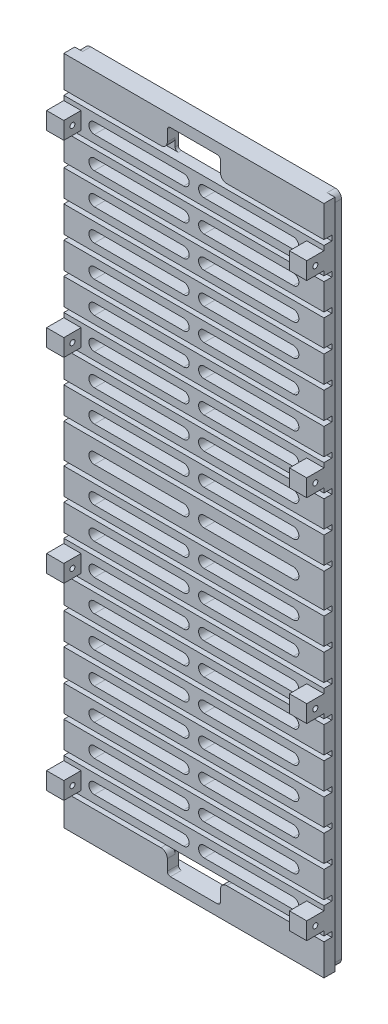
from build123d import *

# Parameters (mm, degrees)
SKETCH1_W                 = 83
SKETCH1_H                 = 214
BOSS_EXTRUDE1_DEPTH       = 8.4
SKETCH2_W                 = 77
SKETCH2_H                 = 4.9
CUT_EXTRUDE1_DEPTH        = 219.148596145
SKETCH3_W                 = 7.4
SKETCH3_H                 = 1.6
CUT_EXTRUDE2_DEPTH        = 136.678148572
LPATTERN1_COUNT           = 10
LPATTERN1_PITCH           = 10
MIRROR8_COPY_1_SKETCH_W   = 7.4
MIRROR8_COPY_1_SKETCH_H   = 1.6
MIRROR8_COPY_1_DEPTH      = 136.678148572
MIRROR8_COPY_2_SKETCH_W   = 7.4
MIRROR8_COPY_2_SKETCH_H   = 1.6
MIRROR8_COPY_2_DEPTH      = 136.678148572
MIRROR8_COPY_3_SKETCH_W   = 7.4
MIRROR8_COPY_3_SKETCH_H   = 1.6
MIRROR8_COPY_3_DEPTH      = 136.678148572
MIRROR8_COPY_4_SKETCH_W   = 7.4
MIRROR8_COPY_4_SKETCH_H   = 1.6
MIRROR8_COPY_4_DEPTH      = 136.678148572
MIRROR8_COPY_5_SKETCH_W   = 7.4
MIRROR8_COPY_5_SKETCH_H   = 1.6
MIRROR8_COPY_5_DEPTH      = 136.678148572
MIRROR8_COPY_6_SKETCH_W   = 7.4
MIRROR8_COPY_6_SKETCH_H   = 1.6
MIRROR8_COPY_6_DEPTH      = 136.678148572
MIRROR8_COPY_7_SKETCH_W   = 7.4
MIRROR8_COPY_7_SKETCH_H   = 1.6
MIRROR8_COPY_7_DEPTH      = 136.678148572
MIRROR8_COPY_8_SKETCH_W   = 7.4
MIRROR8_COPY_8_SKETCH_H   = 1.6
MIRROR8_COPY_8_DEPTH      = 136.678148572
MIRROR8_COPY_9_SKETCH_W   = 7.4
MIRROR8_COPY_9_SKETCH_H   = 1.6
MIRROR8_COPY_9_DEPTH      = 136.678148572
MIRROR8_COPY_10_SKETCH_W  = 7.4
MIRROR8_COPY_10_SKETCH_H  = 1.6
MIRROR8_COPY_10_DEPTH     = 136.678148572
CUT_EXTRUDE6_DEPTH        = 115.870622876
LPATTERN3_COUNT           = 9
LPATTERN3_PITCH           = 10
MIRROR1_COPY_1_DEPTH      = 115.870622876
MIRROR1_COPY_2_DEPTH      = 115.870622876
MIRROR1_COPY_3_DEPTH      = 115.870622876
MIRROR1_COPY_4_DEPTH      = 115.870622876
MIRROR1_COPY_5_DEPTH      = 115.870622876
MIRROR1_COPY_6_DEPTH      = 115.870622876
MIRROR1_COPY_7_DEPTH      = 115.870622876
MIRROR1_COPY_8_DEPTH      = 115.870622876
CUT_EXTRUDE7_DEPTH        = 115.870622876
SOLARBEZEL_DEPTH          = 2.58
M2X0_4_TAPPED_HOLE2_D     = 1.6
M2X0_4_TAPPED_HOLE2_DEPTH = 5.2
M2X0_4_TAPPED_HOLE2_TIP   = 0.480688495
SKETCH19_W                = 10.467012774
SKETCH19_H                = 5.847911184
REMOVEOLDPILLARS_DEPTH    = 219.148596145
SKETCH5_W                 = 5.5
SKETCH5_H                 = 5.5
BOSS_EXTRUDE3_DEPTH       = 5.5
M2X0_4_TAPPED_HOLE5_D     = 1.6
LPATTERN2_COUNT           = 2
LPATTERN2_PITCH           = 60
MIRROR2_COPY_1_SKETCH_W   = 5.5
MIRROR2_COPY_1_SKETCH_H   = 5.5
MIRROR2_COPY_1_DEPTH      = 5.5
MIRROR2_COPY_2_D          = 1.6
MIRROR2_COPY_3_D          = 1.6
MIRROR6_COPY_1_SKETCH_W   = 5.5
MIRROR6_COPY_1_SKETCH_H   = 5.5
MIRROR6_COPY_1_DEPTH      = 5.5
MIRROR6_COPY_2_D          = 1.6
MIRROR6_COPY_3_D          = 1.6
MIRROR6_COPY_4_SKETCH_W   = 5.5
MIRROR6_COPY_4_SKETCH_H   = 5.5
MIRROR6_COPY_4_DEPTH      = 5.5
MIRROR6_COPY_5_SKETCH_W   = 5.5
MIRROR6_COPY_5_SKETCH_H   = 5.5
MIRROR6_COPY_5_DEPTH      = 5.5
MIRROR6_COPY_6_D          = 1.6
MIRROR6_COPY_7_D          = 1.6
MIRROR6_COPY_8_D          = 1.6
CUT_EXTRUDE3_DEPTH        = 116.118417293
FILLET1_R                 = 2


with BuildPart() as part:
    # Sketch1 → Boss-Extrude1 (new body)
    with BuildSketch(Plane.XY):
        Rectangle(SKETCH1_W, SKETCH1_H)
    extrude(amount=BOSS_EXTRUDE1_DEPTH)

    # Sketch2 → Cut-Extrude1 (cut, through all)
    with BuildSketch(Plane(origin=(0, 107, 0), x_dir=(1, 0, 0), z_dir=(0, 1, 0))):
        with Locations((-3, -5.95)):
            Rectangle(SKETCH2_W, SKETCH2_H)
    extrude(amount=-CUT_EXTRUDE1_DEPTH, mode=Mode.SUBTRACT)

    # Sketch3 → Cut-Extrude2 (cut, through all)
    with BuildSketch(Plane(origin=(41.5, 0, 0), x_dir=(0, 0, -1), z_dir=(1, 0, 0))):
        with Locations((-4.7, 96.2)):
            Rectangle(SKETCH3_W, SKETCH3_H)
    cut_extrude2 = extrude(amount=-CUT_EXTRUDE2_DEPTH, mode=Mode.SUBTRACT)

    # LPattern1: Cut-Extrude2 ×10
    with Locations(*[(0, -i * LPATTERN1_PITCH, 0) for i in range(1, LPATTERN1_COUNT)]):
        add(cut_extrude2, mode=Mode.SUBTRACT)

    # Mirror8 copy 1 sketch → Mirror8 copy 1 (cut, through all)
    with BuildSketch(Plane(origin=(41.5, 10, 0), x_dir=(0, 0, -1), z_dir=(1, 0, 0))):
        with Locations((-4.7, -96.2)):
            Rectangle(MIRROR8_COPY_1_SKETCH_W, MIRROR8_COPY_1_SKETCH_H)
    extrude(amount=-MIRROR8_COPY_1_DEPTH, mode=Mode.SUBTRACT)

    # Mirror8 copy 2 sketch → Mirror8 copy 2 (cut, through all)
    with BuildSketch(Plane(origin=(41.5, 20, 0), x_dir=(0, 0, -1), z_dir=(1, 0, 0))):
        with Locations((-4.7, -96.2)):
            Rectangle(MIRROR8_COPY_2_SKETCH_W, MIRROR8_COPY_2_SKETCH_H)
    extrude(amount=-MIRROR8_COPY_2_DEPTH, mode=Mode.SUBTRACT)

    # Mirror8 copy 3 sketch → Mirror8 copy 3 (cut, through all)
    with BuildSketch(Plane(origin=(41.5, 30, 0), x_dir=(0, 0, -1), z_dir=(1, 0, 0))):
        with Locations((-4.7, -96.2)):
            Rectangle(MIRROR8_COPY_3_SKETCH_W, MIRROR8_COPY_3_SKETCH_H)
    extrude(amount=-MIRROR8_COPY_3_DEPTH, mode=Mode.SUBTRACT)

    # Mirror8 copy 4 sketch → Mirror8 copy 4 (cut, through all)
    with BuildSketch(Plane(origin=(41.5, 40, 0), x_dir=(0, 0, -1), z_dir=(1, 0, 0))):
        with Locations((-4.7, -96.2)):
            Rectangle(MIRROR8_COPY_4_SKETCH_W, MIRROR8_COPY_4_SKETCH_H)
    extrude(amount=-MIRROR8_COPY_4_DEPTH, mode=Mode.SUBTRACT)

    # Mirror8 copy 5 sketch → Mirror8 copy 5 (cut, through all)
    with BuildSketch(Plane(origin=(41.5, 50, 0), x_dir=(0, 0, -1), z_dir=(1, 0, 0))):
        with Locations((-4.7, -96.2)):
            Rectangle(MIRROR8_COPY_5_SKETCH_W, MIRROR8_COPY_5_SKETCH_H)
    extrude(amount=-MIRROR8_COPY_5_DEPTH, mode=Mode.SUBTRACT)

    # Mirror8 copy 6 sketch → Mirror8 copy 6 (cut, through all)
    with BuildSketch(Plane(origin=(41.5, 60, 0), x_dir=(0, 0, -1), z_dir=(1, 0, 0))):
        with Locations((-4.7, -96.2)):
            Rectangle(MIRROR8_COPY_6_SKETCH_W, MIRROR8_COPY_6_SKETCH_H)
    extrude(amount=-MIRROR8_COPY_6_DEPTH, mode=Mode.SUBTRACT)

    # Mirror8 copy 7 sketch → Mirror8 copy 7 (cut, through all)
    with BuildSketch(Plane(origin=(41.5, 70, 0), x_dir=(0, 0, -1), z_dir=(1, 0, 0))):
        with Locations((-4.7, -96.2)):
            Rectangle(MIRROR8_COPY_7_SKETCH_W, MIRROR8_COPY_7_SKETCH_H)
    extrude(amount=-MIRROR8_COPY_7_DEPTH, mode=Mode.SUBTRACT)

    # Mirror8 copy 8 sketch → Mirror8 copy 8 (cut, through all)
    with BuildSketch(Plane(origin=(41.5, 80, 0), x_dir=(0, 0, -1), z_dir=(1, 0, 0))):
        with Locations((-4.7, -96.2)):
            Rectangle(MIRROR8_COPY_8_SKETCH_W, MIRROR8_COPY_8_SKETCH_H)
    extrude(amount=-MIRROR8_COPY_8_DEPTH, mode=Mode.SUBTRACT)

    # Mirror8 copy 9 sketch → Mirror8 copy 9 (cut, through all)
    with BuildSketch(Plane(origin=(41.5, 90, 0), x_dir=(0, 0, -1), z_dir=(1, 0, 0))):
        with Locations((-4.7, -96.2)):
            Rectangle(MIRROR8_COPY_9_SKETCH_W, MIRROR8_COPY_9_SKETCH_H)
    extrude(amount=-MIRROR8_COPY_9_DEPTH, mode=Mode.SUBTRACT)

    # Mirror8 copy 10 sketch → Mirror8 copy 10 (cut, through all)
    with BuildSketch(Plane(origin=(41.5, 0, 0), x_dir=(0, 0, -1), z_dir=(1, 0, 0))):
        with Locations((-4.7, -96.2)):
            Rectangle(MIRROR8_COPY_10_SKETCH_W, MIRROR8_COPY_10_SKETCH_H)
    extrude(amount=-MIRROR8_COPY_10_DEPTH, mode=Mode.SUBTRACT)

    # Sketch22 → Cut-Extrude6 (cut, through all)
    with BuildSketch(Plane.XY.offset(3.5)):
        with BuildLine():
            Line((-31.75, 92.95), (-3.25, 92.95))
            ThreePointArc((-3.25, 92.95), (-1.5, 91.2), (-3.25, 89.45))
            Line((-3.25, 89.45), (-31.75, 89.45))
            ThreePointArc((-31.75, 89.45), (-33.5, 91.2), (-31.75, 92.95))
        make_face()
        with BuildLine():
            Line((31.75, 92.95), (3.25, 92.95))
            ThreePointArc((3.25, 92.95), (1.5, 91.2), (3.25, 89.45))
            Line((3.25, 89.45), (31.75, 89.45))
            ThreePointArc((31.75, 89.45), (33.5, 91.2), (31.75, 92.95))
        make_face()
    cut_extrude6 = extrude(amount=-CUT_EXTRUDE6_DEPTH, mode=Mode.SUBTRACT)

    # LPattern3: Cut-Extrude6 ×9
    with Locations(*[(0, -i * LPATTERN3_PITCH, 0) for i in range(1, LPATTERN3_COUNT)]):
        add(cut_extrude6, mode=Mode.SUBTRACT)

    # Mirror1: Cut-Extrude6 across plane
    add(cut_extrude6.mirror(Plane.ZX), mode=Mode.SUBTRACT)

    # Mirror1 copy 1 sketch → Mirror1 copy 1 (cut, through all)
    with BuildSketch(Plane(origin=(0, 10, 3.5), x_dir=(1, 0, 0), z_dir=(0, 0, 1))):
        with BuildLine():
            Line((-31.75, -92.95), (-3.25, -92.95))
            ThreePointArc((-3.25, -92.95), (-1.5, -91.2), (-3.25, -89.45))
            Line((-3.25, -89.45), (-31.75, -89.45))
            ThreePointArc((-31.75, -89.45), (-33.5, -91.2), (-31.75, -92.95))
        make_face()
        with BuildLine():
            Line((31.75, -92.95), (3.25, -92.95))
            ThreePointArc((3.25, -92.95), (1.5, -91.2), (3.25, -89.45))
            Line((3.25, -89.45), (31.75, -89.45))
            ThreePointArc((31.75, -89.45), (33.5, -91.2), (31.75, -92.95))
        make_face()
    extrude(amount=-MIRROR1_COPY_1_DEPTH, mode=Mode.SUBTRACT)

    # Mirror1 copy 2 sketch → Mirror1 copy 2 (cut, through all)
    with BuildSketch(Plane(origin=(0, 20, 3.5), x_dir=(1, 0, 0), z_dir=(0, 0, 1))):
        with BuildLine():
            Line((-31.75, -92.95), (-3.25, -92.95))
            ThreePointArc((-3.25, -92.95), (-1.5, -91.2), (-3.25, -89.45))
            Line((-3.25, -89.45), (-31.75, -89.45))
            ThreePointArc((-31.75, -89.45), (-33.5, -91.2), (-31.75, -92.95))
        make_face()
        with BuildLine():
            Line((31.75, -92.95), (3.25, -92.95))
            ThreePointArc((3.25, -92.95), (1.5, -91.2), (3.25, -89.45))
            Line((3.25, -89.45), (31.75, -89.45))
            ThreePointArc((31.75, -89.45), (33.5, -91.2), (31.75, -92.95))
        make_face()
    extrude(amount=-MIRROR1_COPY_2_DEPTH, mode=Mode.SUBTRACT)

    # Mirror1 copy 3 sketch → Mirror1 copy 3 (cut, through all)
    with BuildSketch(Plane(origin=(0, 30, 3.5), x_dir=(1, 0, 0), z_dir=(0, 0, 1))):
        with BuildLine():
            Line((-31.75, -92.95), (-3.25, -92.95))
            ThreePointArc((-3.25, -92.95), (-1.5, -91.2), (-3.25, -89.45))
            Line((-3.25, -89.45), (-31.75, -89.45))
            ThreePointArc((-31.75, -89.45), (-33.5, -91.2), (-31.75, -92.95))
        make_face()
        with BuildLine():
            Line((31.75, -92.95), (3.25, -92.95))
            ThreePointArc((3.25, -92.95), (1.5, -91.2), (3.25, -89.45))
            Line((3.25, -89.45), (31.75, -89.45))
            ThreePointArc((31.75, -89.45), (33.5, -91.2), (31.75, -92.95))
        make_face()
    extrude(amount=-MIRROR1_COPY_3_DEPTH, mode=Mode.SUBTRACT)

    # Mirror1 copy 4 sketch → Mirror1 copy 4 (cut, through all)
    with BuildSketch(Plane(origin=(0, 40, 3.5), x_dir=(1, 0, 0), z_dir=(0, 0, 1))):
        with BuildLine():
            Line((-31.75, -92.95), (-3.25, -92.95))
            ThreePointArc((-3.25, -92.95), (-1.5, -91.2), (-3.25, -89.45))
            Line((-3.25, -89.45), (-31.75, -89.45))
            ThreePointArc((-31.75, -89.45), (-33.5, -91.2), (-31.75, -92.95))
        make_face()
        with BuildLine():
            Line((31.75, -92.95), (3.25, -92.95))
            ThreePointArc((3.25, -92.95), (1.5, -91.2), (3.25, -89.45))
            Line((3.25, -89.45), (31.75, -89.45))
            ThreePointArc((31.75, -89.45), (33.5, -91.2), (31.75, -92.95))
        make_face()
    extrude(amount=-MIRROR1_COPY_4_DEPTH, mode=Mode.SUBTRACT)

    # Mirror1 copy 5 sketch → Mirror1 copy 5 (cut, through all)
    with BuildSketch(Plane(origin=(0, 50, 3.5), x_dir=(1, 0, 0), z_dir=(0, 0, 1))):
        with BuildLine():
            Line((-31.75, -92.95), (-3.25, -92.95))
            ThreePointArc((-3.25, -92.95), (-1.5, -91.2), (-3.25, -89.45))
            Line((-3.25, -89.45), (-31.75, -89.45))
            ThreePointArc((-31.75, -89.45), (-33.5, -91.2), (-31.75, -92.95))
        make_face()
        with BuildLine():
            Line((31.75, -92.95), (3.25, -92.95))
            ThreePointArc((3.25, -92.95), (1.5, -91.2), (3.25, -89.45))
            Line((3.25, -89.45), (31.75, -89.45))
            ThreePointArc((31.75, -89.45), (33.5, -91.2), (31.75, -92.95))
        make_face()
    extrude(amount=-MIRROR1_COPY_5_DEPTH, mode=Mode.SUBTRACT)

    # Mirror1 copy 6 sketch → Mirror1 copy 6 (cut, through all)
    with BuildSketch(Plane(origin=(0, 60, 3.5), x_dir=(1, 0, 0), z_dir=(0, 0, 1))):
        with BuildLine():
            Line((-31.75, -92.95), (-3.25, -92.95))
            ThreePointArc((-3.25, -92.95), (-1.5, -91.2), (-3.25, -89.45))
            Line((-3.25, -89.45), (-31.75, -89.45))
            ThreePointArc((-31.75, -89.45), (-33.5, -91.2), (-31.75, -92.95))
        make_face()
        with BuildLine():
            Line((31.75, -92.95), (3.25, -92.95))
            ThreePointArc((3.25, -92.95), (1.5, -91.2), (3.25, -89.45))
            Line((3.25, -89.45), (31.75, -89.45))
            ThreePointArc((31.75, -89.45), (33.5, -91.2), (31.75, -92.95))
        make_face()
    extrude(amount=-MIRROR1_COPY_6_DEPTH, mode=Mode.SUBTRACT)

    # Mirror1 copy 7 sketch → Mirror1 copy 7 (cut, through all)
    with BuildSketch(Plane(origin=(0, 70, 3.5), x_dir=(1, 0, 0), z_dir=(0, 0, 1))):
        with BuildLine():
            Line((-31.75, -92.95), (-3.25, -92.95))
            ThreePointArc((-3.25, -92.95), (-1.5, -91.2), (-3.25, -89.45))
            Line((-3.25, -89.45), (-31.75, -89.45))
            ThreePointArc((-31.75, -89.45), (-33.5, -91.2), (-31.75, -92.95))
        make_face()
        with BuildLine():
            Line((31.75, -92.95), (3.25, -92.95))
            ThreePointArc((3.25, -92.95), (1.5, -91.2), (3.25, -89.45))
            Line((3.25, -89.45), (31.75, -89.45))
            ThreePointArc((31.75, -89.45), (33.5, -91.2), (31.75, -92.95))
        make_face()
    extrude(amount=-MIRROR1_COPY_7_DEPTH, mode=Mode.SUBTRACT)

    # Mirror1 copy 8 sketch → Mirror1 copy 8 (cut, through all)
    with BuildSketch(Plane(origin=(0, 80, 3.5), x_dir=(1, 0, 0), z_dir=(0, 0, 1))):
        with BuildLine():
            Line((-31.75, -92.95), (-3.25, -92.95))
            ThreePointArc((-3.25, -92.95), (-1.5, -91.2), (-3.25, -89.45))
            Line((-3.25, -89.45), (-31.75, -89.45))
            ThreePointArc((-31.75, -89.45), (-33.5, -91.2), (-31.75, -92.95))
        make_face()
        with BuildLine():
            Line((31.75, -92.95), (3.25, -92.95))
            ThreePointArc((3.25, -92.95), (1.5, -91.2), (3.25, -89.45))
            Line((3.25, -89.45), (31.75, -89.45))
            ThreePointArc((31.75, -89.45), (33.5, -91.2), (31.75, -92.95))
        make_face()
    extrude(amount=-MIRROR1_COPY_8_DEPTH, mode=Mode.SUBTRACT)

    # Sketch23 → Cut-Extrude7 (cut, through all)
    with BuildSketch(Plane.XY.offset(3.5)):
        with BuildLine():
            Line((-31.75, 1.75), (-3.25, 1.75))
            ThreePointArc((-3.25, 1.75), (-1.5, 0), (-3.25, -1.75))
            Line((-3.25, -1.75), (-31.75, -1.75))
            ThreePointArc((-31.75, -1.75), (-33.5, 0), (-31.75, 1.75))
        make_face()
        with BuildLine():
            Line((31.75, 1.75), (3.25, 1.75))
            ThreePointArc((3.25, 1.75), (1.5, 0), (3.25, -1.75))
            Line((3.25, -1.75), (31.75, -1.75))
            ThreePointArc((31.75, -1.75), (33.5, 0), (31.75, 1.75))
        make_face()
    extrude(amount=-CUT_EXTRUDE7_DEPTH, mode=Mode.SUBTRACT)

    # Sketch4 → solarBezel (add)
    with BuildSketch(Plane(origin=(0, 0, 0), x_dir=(-1, 0, 0), z_dir=(0, 0, -1))):
        with BuildLine():
            Line((-39, 107), (39, 107))
            ThreePointArc((39, 107), (40.414213562, 106.414213562), (41, 105))
            Line((41, 105), (41, -105))
            ThreePointArc((41, -105), (40.414213562, -106.414213562), (39, -107))
            Line((39, -107), (-39, -107))
            ThreePointArc((-39, -107), (-40.414213562, -106.414213562), (-41, -105))
            Line((-41, -105), (-41, 105))
            ThreePointArc((-41, 105), (-40.414213562, 106.414213562), (-39, 107))
        make_face()
        with BuildLine():
            Line((-33.5, -103.5), (33.5, -103.5))
            ThreePointArc((33.5, -103.5), (34.914213562, -102.914213562), (35.5, -101.5))
            Line((35.5, -101.5), (35.5, 101.5))
            ThreePointArc((35.5, 101.5), (34.914213562, 102.914213562), (33.5, 103.5))
            Line((33.5, 103.5), (-33.5, 103.5))
            ThreePointArc((-33.5, 103.5), (-34.914213562, 102.914213562), (-35.5, 101.5))
            Line((-35.5, 101.5), (-35.5, -101.5))
            ThreePointArc((-35.5, -101.5), (-34.914213562, -102.914213562), (-33.5, -103.5))
        make_face(mode=Mode.SUBTRACT)
    extrude(amount=SOLARBEZEL_DEPTH)

    # M2x0.4 Tapped Hole2
    with Locations(Plane(origin=(0, 0, -2.58), x_dir=(-1, 0, 0), z_dir=(0, 0, -1))):
        with Locations((-38, 102), (38, 102), (38, 72), (38, 42), (38, 12), (-38, 72), (-38, 42), (-38, 12), (38, -102), (-38, -12), (-38, -42), (-38, -72), (38, -12), (38, -42), (38, -72), (-38, -102)):
            Hole(M2X0_4_TAPPED_HOLE2_D / 2, depth=M2X0_4_TAPPED_HOLE2_DEPTH)
            with Locations((0, 0, -(M2X0_4_TAPPED_HOLE2_DEPTH + M2X0_4_TAPPED_HOLE2_TIP / 2))):  # 118° drill point
                Cone(0, M2X0_4_TAPPED_HOLE2_D / 2, M2X0_4_TAPPED_HOLE2_TIP, mode=Mode.SUBTRACT)

    # Sketch19 → removeOldPillars (cut, through all)
    with BuildSketch(Plane.XZ.offset(107)):
        with Locations((40.733506387, 6.423955592)):
            Rectangle(SKETCH19_W, SKETCH19_H)
    extrude(amount=-REMOVEOLDPILLARS_DEPTH, mode=Mode.SUBTRACT)

    # Sketch5 → Boss-Extrude3 (add)
    with BuildSketch(Plane.XY.offset(3.5)):
        with Locations((-38.75, 91.2)):
            Rectangle(SKETCH5_W, SKETCH5_H)
    boss_extrude3 = extrude(amount=BOSS_EXTRUDE3_DEPTH)

    # M2x0.4 Tapped Hole5 (through all)
    with Locations(Plane.ZY.offset(41.5)):
        with Locations((6.25, 91.2)):
            m2x0_4_tapped_hole5 = Hole(M2X0_4_TAPPED_HOLE5_D / 2)

    # LPattern2: Boss-Extrude3, M2x0.4 Tapped Hole5 ×2
    with Locations(*[(0, -i * LPATTERN2_PITCH, 0) for i in range(1, LPATTERN2_COUNT)]):
        add(boss_extrude3)
        add(m2x0_4_tapped_hole5, mode=Mode.SUBTRACT)

    # Mirror2: Boss-Extrude3 across plane
    add(boss_extrude3.mirror(Plane.ZX))

    # Mirror2 copy 1 sketch → Mirror2 copy 1 (add)
    with BuildSketch(Plane(origin=(0, 60, 3.5), x_dir=(1, 0, 0), z_dir=(0, 0, 1))):
        with Locations((-38.75, -91.2)):
            Rectangle(MIRROR2_COPY_1_SKETCH_W, MIRROR2_COPY_1_SKETCH_H)
    extrude(amount=MIRROR2_COPY_1_DEPTH)

    # Mirror2 copy 2 (through all)
    with Locations(Plane(origin=(-41.5, 60, 0), x_dir=(0, 0, 1), z_dir=(-1, 0, 0))):
        with Locations((6.25, -91.2)):
            Hole(MIRROR2_COPY_2_D / 2)

    # Mirror2 copy 3 (through all)
    with Locations(Plane.ZY.offset(41.5)):
        with Locations((6.25, -91.2)):
            Hole(MIRROR2_COPY_3_D / 2)

    # Mirror6: Boss-Extrude3 across plane
    add(boss_extrude3.mirror(Plane(origin=(0, 0, 0), x_dir=(0, 0, 1), z_dir=(1, 0, 0))))

    # Mirror6 copy 1 sketch → Mirror6 copy 1 (add)
    with BuildSketch(Plane(origin=(0, -60, 3.5), x_dir=(-1, 0, 0), z_dir=(0, 0, 1))):
        with Locations((-38.75, -91.2)):
            Rectangle(MIRROR6_COPY_1_SKETCH_W, MIRROR6_COPY_1_SKETCH_H)
    extrude(amount=MIRROR6_COPY_1_DEPTH)

    # Mirror6 copy 2 (through all)
    with Locations(Plane(origin=(41.5, -60, 0), x_dir=(0, 0, 1), z_dir=(1, 0, 0))):
        with Locations((6.25, -91.2)):
            Hole(MIRROR6_COPY_2_D / 2)

    # Mirror6 copy 3 (through all)
    with Locations(Plane(origin=(41.5, 0, 0), x_dir=(0, 0, 1), z_dir=(1, 0, 0))):
        with Locations((6.25, -91.2)):
            Hole(MIRROR6_COPY_3_D / 2)

    # Mirror6 copy 4 sketch → Mirror6 copy 4 (add)
    with BuildSketch(Plane(origin=(0, 0, 3.5), x_dir=(-1, 0, 0), z_dir=(0, 0, 1))):
        with Locations((-38.75, 91.2)):
            Rectangle(MIRROR6_COPY_4_SKETCH_W, MIRROR6_COPY_4_SKETCH_H)
    extrude(amount=MIRROR6_COPY_4_DEPTH)

    # Mirror6 copy 5 sketch → Mirror6 copy 5 (add)
    with BuildSketch(Plane(origin=(0, 60, 3.5), x_dir=(-1, 0, 0), z_dir=(0, 0, 1))):
        with Locations((-38.75, 91.2)):
            Rectangle(MIRROR6_COPY_5_SKETCH_W, MIRROR6_COPY_5_SKETCH_H)
    extrude(amount=MIRROR6_COPY_5_DEPTH)

    # Mirror6 copy 6 (through all)
    with Locations(Plane(origin=(41.5, 60, 0), x_dir=(0, 0, 1), z_dir=(1, 0, 0))):
        with Locations((6.25, 91.2)):
            Hole(MIRROR6_COPY_6_D / 2)

    # Mirror6 copy 7 (through all)
    with Locations(Plane(origin=(41.5, 0, 0), x_dir=(0, 0, 1), z_dir=(1, 0, 0))):
        with Locations((6.25, 91.2)):
            Hole(MIRROR6_COPY_7_D / 2)

    # Mirror6 copy 8 (through all)
    with Locations(Plane(origin=(41.5, 0, 0), x_dir=(0, 0, 1), z_dir=(1, 0, 0))):
        with Locations((6.25, -91.2)):
            Hole(MIRROR6_COPY_8_D / 2)

    # Sketch6 → Cut-Extrude3 (cut, through all)
    with BuildSketch(Plane(origin=(0, 0, 0), x_dir=(-1, 0, 0), z_dir=(0, 0, -1))):
        with BuildLine():
            Line((-7.475, 95.4), (7.475, 95.4))
            ThreePointArc((7.475, 95.4), (8.182106781, 95.692893219), (8.475, 96.4))
            Line((8.475, 96.4), (8.475, 102.5))
            ThreePointArc((8.475, 102.5), (8.182106781, 103.207106781), (7.475, 103.5))
            Line((7.475, 103.5), (-7.475, 103.5))
            ThreePointArc((-7.475, 103.5), (-8.182106781, 103.207106781), (-8.475, 102.5))
            Line((-8.475, 102.5), (-8.475, 96.4))
            ThreePointArc((-8.475, 96.4), (-8.182106781, 95.692893219), (-7.475, 95.4))
        make_face()
    cut_extrude3 = extrude(amount=-CUT_EXTRUDE3_DEPTH, mode=Mode.SUBTRACT)

    # Mirror3: Cut-Extrude3 across plane
    add(cut_extrude3.mirror(Plane.ZX), mode=Mode.SUBTRACT)

    # Fillet1
    fillet1_edges = [part.edges().sort_by_distance(p)[0] for p in [
        (8.475, 97, 2.25),
        (-8.475, 97, 2.25),
        (8.475, -97, 2.25),
        (-8.475, -97, 2.25),
    ]]
    fillet(fillet1_edges, radius=FILLET1_R)


solid = part.part
